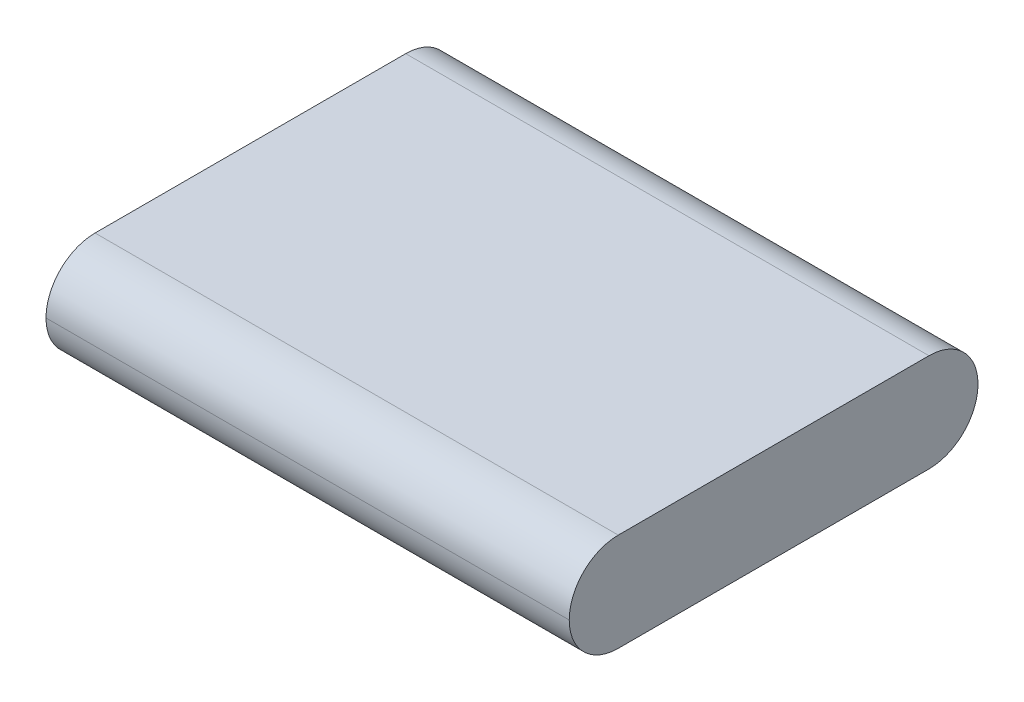
from build123d import *

# Parameters (mm, degrees)
SKETCH_1_W      = 32
SKETCH_1_H      = 25
EXTRUDE_1_DEPTH = 6
FILLET_1_R      = 3


with BuildPart() as part:
    # 草图1 → 凸台-拉伸1 (new body)
    with BuildSketch(Plane(origin=(0, 0, 0), x_dir=(1, 0, 0), z_dir=(0, 1, 0))):
        Rectangle(SKETCH_1_W, SKETCH_1_H)
    extrude(amount=EXTRUDE_1_DEPTH)

    # 圆角1
    fillet_1_edges = [part.edges().sort_by_distance(p)[0] for p in [
        (0, 0, -12.5),
        (0, 6, -12.5),
        (0, 6, 12.5),
        (0, 0, 12.5),
    ]]
    fillet(fillet_1_edges, radius=FILLET_1_R - 0.0001)  # a hair under: the kernel refuses the full size


solid = part.part
